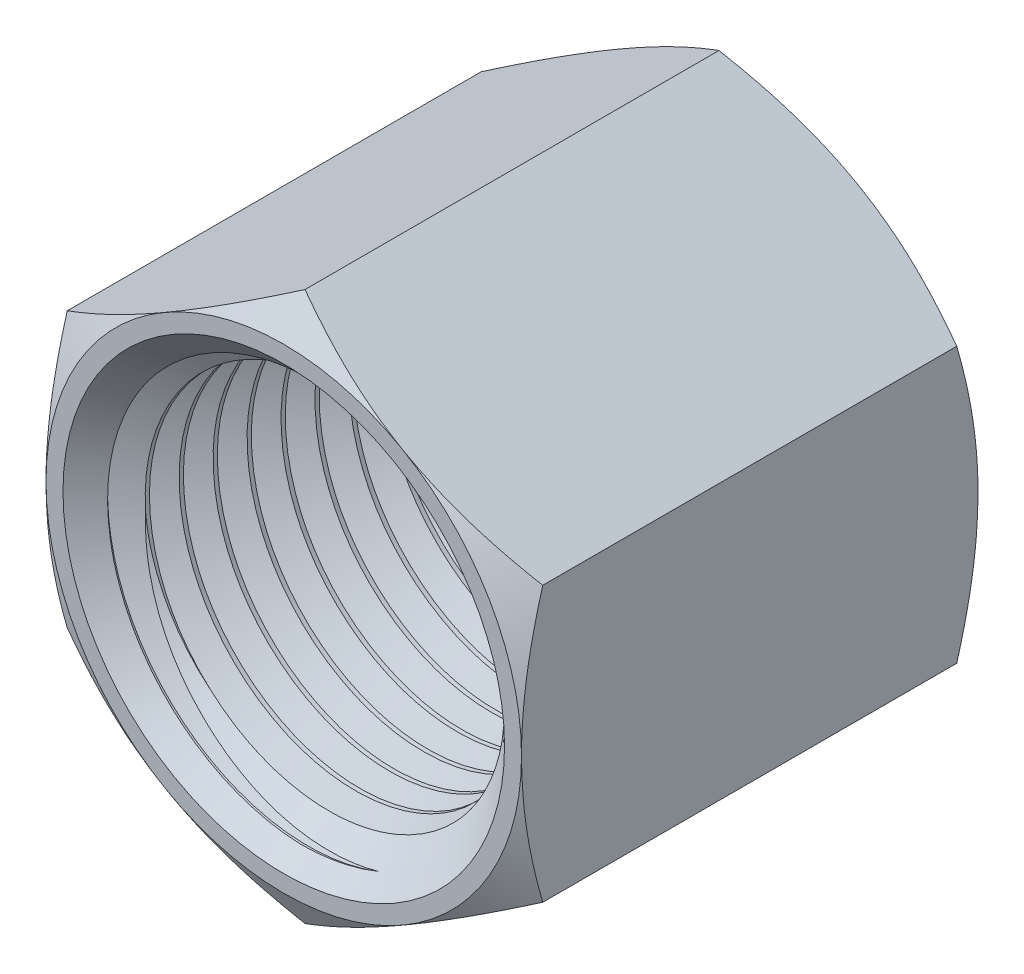
from build123d import *

# Parameters (mm, degrees)
BOSS_EXTRUDE1_DEPTH          = 10.668
BOSS_EXTRUDE1_DEPTH_BACK     = 10.668
SKETCH2_R                    = 7.239
SKETCH4_OUTSIDE_W            = 41.044
SKETCH4_OUTSIDE_H            = 44.482
SKETCH4_OUTSIDE_R            = 11.1125
CUT_EXTRUDE1_DEPTH           = 2.54
CUT_EXTRUDE1_DRAFT           = -60
MIRROR1_COPY_1_SKETCH_W      = 41.044
MIRROR1_COPY_1_SKETCH_H      = 44.482
MIRROR1_COPY_1_SKETCH_R      = 11.1125
MIRROR1_COPY_1_DEPTH         = 2.54
MIRROR1_COPY_1_DRAFT         = -60
SWEEP1_PITCH                 = 1.5875
SKETCH7_R                    = 10.31875
CUT_EXTRUDE2_DEPTH           = 2.54
CUT_EXTRUDE2_TAPER           = 45
CUT_EXTRUDE2_OTHER_WAY_DEPTH = 28.264679767


with BuildPart() as part:
    # Sketch2 → Boss-Extrude1 (new, two sides: drawn at the far end of the back side and taken through both)
    with BuildSketch(Plane.XY.offset(-BOSS_EXTRUDE1_DEPTH_BACK)):
        Polygon((0, 12.831609733), (-11.1125, 6.415804866), (-11.1125, -6.415804866), (0, -12.831609733), (11.1125, -6.415804866), (11.1125, 6.415804866), align=None)
        Circle(SKETCH2_R, mode=Mode.SUBTRACT)
    extrude(amount=BOSS_EXTRUDE1_DEPTH + BOSS_EXTRUDE1_DEPTH_BACK)

    # Sketch3 → Cut-Revolve1 (revolve, cut)
    with BuildSketch(Plane(origin=(0, 0, 0), x_dir=(0, 0, -1), z_dir=(1, 0, 0)), mode=Mode.PRIVATE) as cut_revolve1_sk:
        Polygon((-10.668, 9.525), (2.667, 9.525), (8.001, 7.239), (10.668, 7.239), (10.668, 0), (-10.668, 0), align=None)
    revolve(cut_revolve1_sk.sketch.rotate(Axis((0, 0, 10.668), (0, 0, -1)), 90), axis=Axis((0, 0, 10.668), (0, 0, -1)), mode=Mode.SUBTRACT)


with BuildPart() as cut_extrude1_tool:
    # Sketch4 outside → Cut-Extrude1 (with draft: the straight prism first)
    with BuildSketch(Plane.XY.offset(10.668)):
        Rectangle(SKETCH4_OUTSIDE_W, SKETCH4_OUTSIDE_H)
        Circle(SKETCH4_OUTSIDE_R, mode=Mode.SUBTRACT)
    extrude(amount=-CUT_EXTRUDE1_DEPTH)
    # Cut-Extrude1: the draft: its side faces are tilted about the plane it starts from
    cut_extrude1_sides = [cut_extrude1_tool.faces().sort_by_distance(p)[0] for p in [
        (0, -22.241, 9.398),
        (20.522, 0, 9.398),
        (0, 22.241, 9.398),
        (-20.522, 0, 9.398),
        (-11.1125, 0, 9.398),
    ]]
    draft(cut_extrude1_sides, Plane.XY.offset(10.668), CUT_EXTRUDE1_DRAFT)


with BuildPart() as part_1:
    add(part.part)

    # Cut-Extrude1: cut by cut_extrude1_tool
    add(cut_extrude1_tool.part, mode=Mode.SUBTRACT)


with BuildPart() as mirror1_copy_1_tool:
    # Mirror1 copy 1 sketch → Mirror1 copy 1 (with draft: the straight prism first)
    with BuildSketch(Plane(origin=(0, 0, -10.668), x_dir=(1, 0, 0), z_dir=(0, 0, -1))):
        Rectangle(MIRROR1_COPY_1_SKETCH_W, MIRROR1_COPY_1_SKETCH_H)
        Circle(MIRROR1_COPY_1_SKETCH_R, mode=Mode.SUBTRACT)
    extrude(amount=-MIRROR1_COPY_1_DEPTH)
    # Mirror1 copy 1: the draft: its side faces are tilted about the plane it starts from
    mirror1_copy_1_sides = [mirror1_copy_1_tool.faces().sort_by_distance(p)[0] for p in [
        (0, -22.241, -9.398),
        (20.522, 0, -9.398),
        (0, 22.241, -9.398),
        (-20.522, 0, -9.398),
        (-11.1125, 0, -9.398),
    ]]
    draft(mirror1_copy_1_sides, Plane(origin=(0, 0, -10.668), x_dir=(1, 0, 0), z_dir=(0, 0, -1)), MIRROR1_COPY_1_DRAFT)


with BuildPart() as part_2:
    add(part_1.part)

    # Mirror1 copy 1: cut by mirror1_copy_1_tool
    add(mirror1_copy_1_tool.part, mode=Mode.SUBTRACT)

    # Sweep1: the profile of Sketch6 profile screwed along a right-hand helix of 10.08 turns, 8 arcs to a turn; built about Z, then put on its axis
    sweep1_z = Axis((0, 0, 0), (0, 0, 1))
    sweep1_corners = [(9.5253, 0, 0.000173205), (8.407962546, 0, -0.644921875), (8.407962546, 0, -0.843359375), (9.5253, 0, -1.488454455)]
    with BuildLine(mode=Mode.PRIVATE) as sweep1_profile:
        Line(sweep1_corners[0], sweep1_corners[1])
        Line(sweep1_corners[1], sweep1_corners[2])
        Line(sweep1_corners[2], sweep1_corners[3])
        Line(sweep1_corners[3], sweep1_corners[0])
    sweep1_cap = Face(sweep1_profile.wire())
    sweep1_turn_angles = [0, 22.5, 45, 67.5, 90, 112.5, 135, 157.5, 180, 202.5, 225, 247.5, 270, 292.5, 315, 337.5, 360]
    sweep1_turn_weights = [1, 0.9238795325112867, 1, 0.9238795325112867, 1, 0.9238795325112867, 1, 0.9238795325112867, 1, 0.9238795325112867, 1, 0.9238795325112867, 1, 0.9238795325112867, 1, 0.9238795325112867, 1]
    sweep1_turn_rails = [Edge.make_bspline([Vector(p[0], p[1], 0).rotate(sweep1_z, sweep1_turn_angles[k]) / sweep1_turn_weights[k] + Vector(0, 0, p[2] + SWEEP1_PITCH * sweep1_turn_angles[k] / 360) for k in range(17)], [0, 0, 0, 1, 1, 2, 2, 3, 3, 4, 4, 5, 5, 6, 6, 7, 7, 8, 8, 8], 2, sweep1_turn_weights) for p in sweep1_corners]
    sweep1_turn_sides = [Face.make_surface_from_curves(sweep1_turn_rails[p[0]], sweep1_turn_rails[p[1]]) for p in [(0, 1), (1, 2), (2, 3), (3, 0)]]
    sweep1_last_angles = [3600, 3614.4, 3628.8]
    sweep1_last_weights = [1, 0.9685831611286366, 1]
    sweep1_last_rails = [Edge.make_bspline([Vector(p[0], p[1], 0).rotate(sweep1_z, sweep1_last_angles[k]) / sweep1_last_weights[k] + Vector(0, 0, p[2] + SWEEP1_PITCH * sweep1_last_angles[k] / 360) for k in range(3)], [0, 0, 0, 1, 1, 1], 2, sweep1_last_weights) for p in sweep1_corners]
    sweep1_last_sides = [Face.make_surface_from_curves(sweep1_last_rails[p[0]], sweep1_last_rails[p[1]]) for p in [(0, 1), (1, 2), (2, 3), (3, 0)]]
    sweep1 = Plane(origin=(0, 0, 10.668), x_dir=(0, 1, 0), z_dir=(0, 0, -1)) * Solid(Shell([*[p.moved(Location((0, 0, SWEEP1_PITCH * i))) for i in range(10) for p in sweep1_turn_sides], *sweep1_last_sides, sweep1_cap, sweep1_cap.rotate(sweep1_z, 3628.8).moved(Location((0, 0, SWEEP1_PITCH * 3628.8 / 360)))]))
    add(sweep1)

    # Sketch7 → Cut-Extrude2 (cut)
    with BuildSketch(Plane.XY.offset(10.668)):
        Circle(SKETCH7_R)
    extrude(amount=-CUT_EXTRUDE2_DEPTH, taper=CUT_EXTRUDE2_TAPER, mode=Mode.SUBTRACT)

    # Sketch7 → Cut-Extrude2 other way (cut)
    with BuildSketch(Plane.XY.offset(10.668)):
        Circle(SKETCH7_R)
    extrude(amount=CUT_EXTRUDE2_OTHER_WAY_DEPTH, mode=Mode.SUBTRACT)


solid = part_2.part
